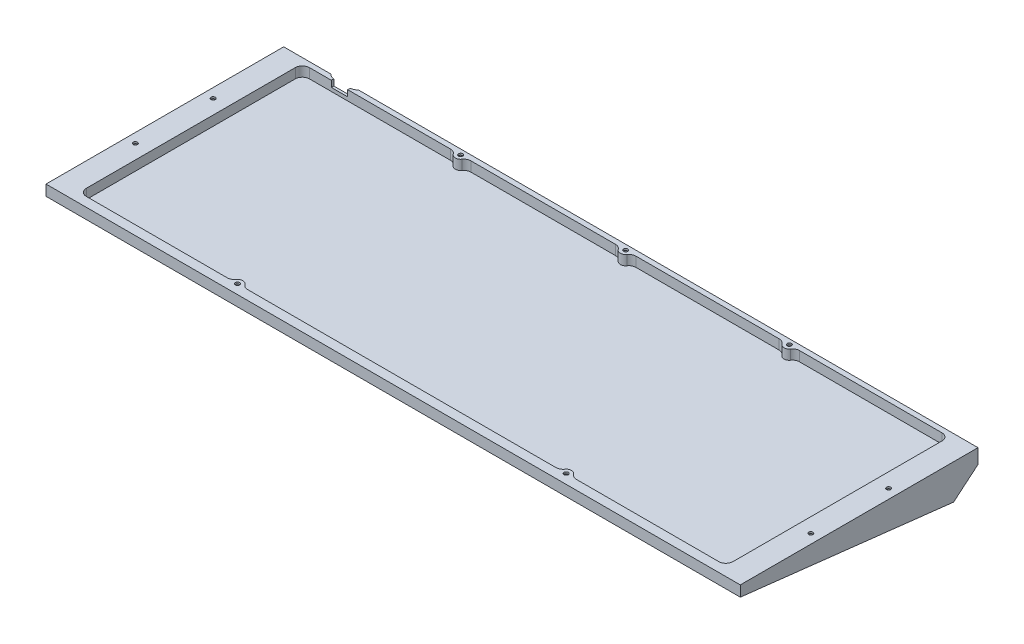
from build123d import *

# Parameters (mm, degrees)
SKETCH1_W               = 390.8
SKETCH1_H               = 133.8
BOSS_EXTRUDE1_DEPTH     = 6
SKETCH2_W               = 364
SKETCH2_H               = 125.6
CUT_EXTRUDE1_DEPTH      = 5.5
BOSS_EXTRUDE3_DEPTH     = 390.8
SKETCH8_W               = 9.2
SKETCH8_H               = 3.5
CUT_EXTRUDE2_DEPTH      = 10
BOSS_EXTRUDE4_DEPTH     = 5.5
SKETCH11_W              = 15.2
SKETCH11_H              = 5.5
CUT_EXTRUDE3_DEPTH      = 1.5
CUT_EXTRUDE6_DEPTH      = 414.351517904
CUT_EXTRUDE6_DEPTH_BACK = 414.351517904
FILLET1_R               = 4
M2_CLEARANCE_HOLE1_D    = 2.4
CUT_EXTRUDE7_START      = -1
SKETCH13_R              = 2.5
CUT_EXTRUDE7_DEPTH      = 413.538863107
FILLET2_R               = 4


with BuildPart() as part:
    # Sketch1 → Boss-Extrude1 (new body)
    with BuildSketch(Plane(origin=(0, 0, 0), x_dir=(1, 0, 0), z_dir=(0, 1, 0))):
        with Locations((195.4, 66.9)):
            Rectangle(SKETCH1_W, SKETCH1_H)
    extrude(amount=BOSS_EXTRUDE1_DEPTH)

    # Sketch2 → Cut-Extrude1 (cut)
    with BuildSketch(Plane(origin=(0, 6, 0), x_dir=(1, 0, 0), z_dir=(0, 1, 0))):
        with Locations((195.4, 68.1)):
            Rectangle(SKETCH2_W, SKETCH2_H)
    extrude(amount=-CUT_EXTRUDE1_DEPTH, mode=Mode.SUBTRACT)

    # Boss-Extrude3: read off the stored shape, not the designer's step
    # Boss-Extrude3 outline → Boss-Extrude3 (add)
    with BuildSketch(Plane.YZ):
        Polygon((-15.244584391, -133.8), (0, -133.8), (0, 0), align=None)
    extrude(amount=BOSS_EXTRUDE3_DEPTH)

    # Sketch8 → Cut-Extrude2 (cut)
    with BuildSketch(Plane(origin=(0, 0, -133.8), x_dir=(-1, 0, 0), z_dir=(0, 0, -1))):
        with Locations((-34.3, 4.25)):
            Rectangle(SKETCH8_W, SKETCH8_H)
    extrude(amount=-CUT_EXTRUDE2_DEPTH, mode=Mode.SUBTRACT)

    # Sketch10 → Boss-Extrude4 (add)
    with BuildSketch(Plane(origin=(0, 0.5, 0), x_dir=(1, 0, 0), z_dir=(0, 1, 0))):
        with BuildLine():
            Line((99.5, 5.3), (105.5, 5.3))
            ThreePointArc((105.5, 5.3), (102.5, 8.3), (99.5, 5.3))
        make_face()
        with BuildLine():
            ThreePointArc((290.5, 5.3), (287.5, 8.3), (284.5, 5.3))
            Line((284.5, 5.3), (290.5, 5.3))
        make_face()
        with BuildLine():
            Line((105.5, 130.9), (99.5, 130.9))
            ThreePointArc((99.5, 130.9), (102.5, 127.9), (105.5, 130.9))
        make_face()
        with BuildLine():
            ThreePointArc((284.5, 130.9), (287.5, 127.9), (290.5, 130.9))
            Line((290.5, 130.9), (284.5, 130.9))
        make_face()
        with BuildLine():
            Line((198.4, 130.9), (192.4, 130.9))
            ThreePointArc((192.4, 130.9), (195.4, 127.9), (198.4, 130.9))
        make_face()
    extrude(amount=BOSS_EXTRUDE4_DEPTH)

    # Sketch11 → Cut-Extrude3 (cut)
    with BuildSketch(Plane(origin=(0, 0, -133.8), x_dir=(-1, 0, 0), z_dir=(0, 0, -1))):
        with Locations((-34.3, 3.25)):
            Rectangle(SKETCH11_W, SKETCH11_H)
    extrude(amount=-CUT_EXTRUDE3_DEPTH, mode=Mode.SUBTRACT)

    # Sketch12 → Cut-Extrude6 (cut, two sides: drawn at the far end of the back side and taken through both)
    with BuildSketch(Plane.ZY.offset(-CUT_EXTRUDE6_DEPTH_BACK)):
        Polygon((-133.8, -15.244584391), (-120.069803619, -13.680226114), (-133.8, -2.2), align=None)
    extrude(amount=CUT_EXTRUDE6_DEPTH + CUT_EXTRUDE6_DEPTH_BACK, mode=Mode.SUBTRACT)

    # Fillet1
    fillet1_edges = [part.edges().sort_by_distance(p)[0] for p in [
        (13.4, 3.25, -5.3),
        (13.4, 3.25, -130.9),
        (377.4, 3.25, -130.9),
        (377.4, 3.25, -5.3),
        (99.5, 3.25, -130.9),
        (105.5, 3.25, -130.9),
        (192.4, 3.25, -130.9),
        (198.4, 3.25, -130.9),
        (284.5, 3.25, -130.9),
        (290.5, 3.25, -130.9),
        (290.5, 3.25, -5.3),
        (284.5, 3.25, -5.3),
        (105.5, 3.25, -5.3),
        (99.5, 3.25, -5.3),
    ]]
    fillet(fillet1_edges, radius=FILLET1_R)

    # M2 Clearance Hole1 (through all)
    with Locations(Plane(origin=(102.5, 6, -5.3), x_dir=(0, 0, 1), z_dir=(0, 1, 0))):
        with Locations((0, 0), (-39.7, -97.2), (-83.5, -97.2), (-125.6, 0), (-125.6, 92.9), (-125.6, 185), (-83.5, 283), (-39.7, 283), (0, 185)):
            Hole(M2_CLEARANCE_HOLE1_D / 2)

    # Sketch13 → Cut-Extrude7 (cut, through all)
    with BuildSketch(Plane(origin=(0, 6, 0), x_dir=(1, 0, 0), z_dir=(0, 1, 0)).offset(CUT_EXTRUDE7_START)):
        with Locations(Location((5.3, 45, 0), (0, 0, 270))):
            Circle(SKETCH13_R)
        with Locations(Location((5.3, 88.8, 0), (0, 0, 270))):
            Circle(SKETCH13_R)
        with Locations(Location((102.5, 5.3, 0), (0, 0, 270))):
            Circle(SKETCH13_R)
        with Locations(Location((287.5, 5.3, 0), (0, 0, 270))):
            Circle(SKETCH13_R)
        with Locations(Location((385.5, 45, 0), (0, 0, 270))):
            Circle(SKETCH13_R)
        with Locations(Location((385.5, 88.8, 0), (0, 0, 270))):
            Circle(SKETCH13_R)
        with Locations(Location((287.5, 130.9, 0), (0, 0, 270))):
            Circle(SKETCH13_R)
        with Locations(Location((195.4, 130.9, 0), (0, 0, 270))):
            Circle(SKETCH13_R)
        with Locations(Location((102.5, 130.9, 0), (0, 0, 270))):
            Circle(SKETCH13_R)
    extrude(amount=-CUT_EXTRUDE7_DEPTH, mode=Mode.SUBTRACT)

    # Fillet2
    # the kernel refuses this fillet: 4 mm, written as the material it adds along each edge
    with BuildSketch(Plane(origin=(41.9, -7.306247498, -132.3), x_dir=(-1, 0, 0), z_dir=(0, 1, 0))) as fillet2_piece_1_section:
        with BuildLine():
            CenterArc((3.122498999, -4), FILLET2_R, 90, 51.317812547)
            Line((0, -1.5), (0, 0))
            Line((0, 0), (3.122498999, 0))
        make_face()
    fillet2_piece_1 = extrude(amount=21.112494996, mode=Mode.PRIVATE)
    fillet2_piece_1 = split(fillet2_piece_1, bisect_by=Plane(origin=(41.9, 2.5, -132.3), z_dir=(0, -1, 0)), keep=Keep.TOP, mode=Mode.PRIVATE)
    fillet2_piece_1 = split(fillet2_piece_1, bisect_by=Plane(origin=(41.9, -5.039151199, -130.404413264), z_dir=(0, 0.7671651518152931, 0.6414496315691656)), keep=Keep.TOP, mode=Mode.PRIVATE)
    add(fillet2_piece_1)
    with BuildSketch(Plane(origin=(41.9, -7.306247498, -132.3), x_dir=(-1, 0, 0), z_dir=(0, 1, 0))) as fillet2_piece_2_section:
        with BuildLine():
            CenterArc((3.122498999, -4), FILLET2_R, 90, 51.317812547)
            Line((0, -1.5), (0, 0))
            Line((0, 0), (3.122498999, 0))
        make_face()
    fillet2_piece_2 = extrude(amount=13.306247498, mode=Mode.PRIVATE)
    fillet2_piece_2 = split(fillet2_piece_2, bisect_by=Plane(origin=(38.9, -7.306247498, -132.3), z_dir=(1, 0, 0)), keep=Keep.TOP, mode=Mode.PRIVATE)
    fillet2_piece_2 = split(fillet2_piece_2, bisect_by=Plane(origin=(41.9, -5.039151199, -130.404413264), z_dir=(0, 0.7671651518152931, 0.6414496315691656)), keep=Keep.TOP, mode=Mode.PRIVATE)
    add(fillet2_piece_2)
    with BuildSketch(Plane(origin=(26.7, 6, -132.3), x_dir=(1, 0, 0), z_dir=(0, -1, 0))) as fillet2_piece_3_section:
        with BuildLine():
            CenterArc((3.122498999, -4), FILLET2_R, 90, 51.317812547)
            Line((0, -1.5), (0, 0))
            Line((0, 0), (3.122498999, 0))
        make_face()
    fillet2_piece_3 = extrude(amount=13.306247498, mode=Mode.PRIVATE)
    fillet2_piece_3 = split(fillet2_piece_3, bisect_by=Plane(origin=(29.7, 6, -132.3), z_dir=(-1, 0, 0)), keep=Keep.TOP, mode=Mode.PRIVATE)
    fillet2_piece_3 = split(fillet2_piece_3, bisect_by=Plane(origin=(26.7, 0.435805859, -136.952388437), z_dir=(0, 0.7671651518152931, 0.6414496315691656)), keep=Keep.TOP, mode=Mode.PRIVATE)
    add(fillet2_piece_3)
    with BuildSketch(Plane(origin=(26.7, 13.806247498, -132.3), x_dir=(1, 0, 0), z_dir=(0, -1, 0))) as fillet2_piece_4_section:
        with BuildLine():
            CenterArc((3.122498999, -4), FILLET2_R, 90, 51.317812547)
            Line((0, -1.5), (0, 0))
            Line((0, 0), (3.122498999, 0))
        make_face()
    fillet2_piece_4 = extrude(amount=21.112494996, mode=Mode.PRIVATE)
    fillet2_piece_4 = split(fillet2_piece_4, bisect_by=Plane(origin=(26.7, 2.5, -132.3), z_dir=(0, -1, 0)), keep=Keep.TOP, mode=Mode.PRIVATE)
    fillet2_piece_4 = split(fillet2_piece_4, bisect_by=Plane(origin=(26.7, 3.647745952, -140.793825689), z_dir=(0, 0.7671651518152931, 0.6414496315691656)), keep=Keep.TOP, mode=Mode.PRIVATE)
    add(fillet2_piece_4)


solid = part.part
